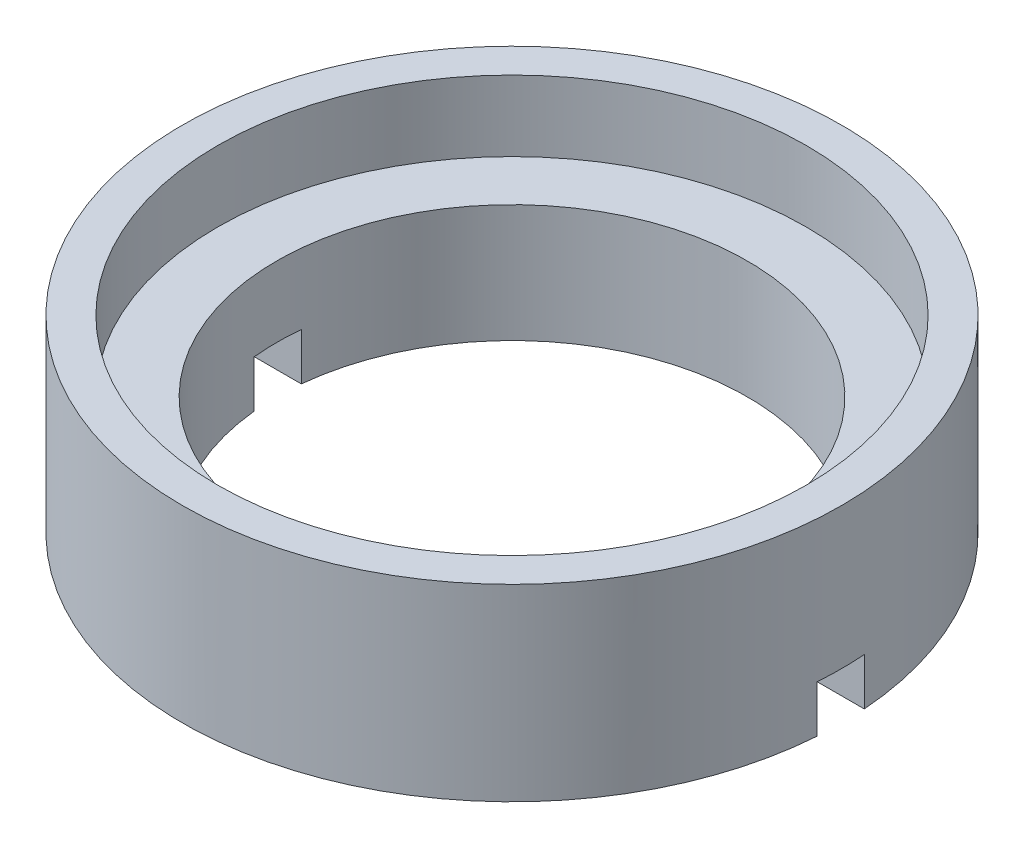
from build123d import *

# Parameters (mm, degrees)
SKETCH1_R           = 7
BOSS_EXTRUDE1_DEPTH = 4
SKETCH2_R           = 6.25
CUT_EXTRUDE1_DEPTH  = 1.5
SKETCH3_R           = 5
CUT_EXTRUDE2_DEPTH  = 11.677078252
SKETCH4_W           = 16
SKETCH4_H           = 1
CUT_EXTRUDE3_DEPTH  = 1


with BuildPart() as part:
    # Sketch1 → Boss-Extrude1 (new body)
    with BuildSketch(Plane(origin=(0, 0, 0), x_dir=(1, 0, 0), z_dir=(0, 1, 0))):
        Circle(SKETCH1_R)
    extrude(amount=BOSS_EXTRUDE1_DEPTH)

    # Sketch2 → Cut-Extrude1 (cut)
    with BuildSketch(Plane(origin=(0, 4, 0), x_dir=(1, 0, 0), z_dir=(0, 1, 0))):
        Circle(SKETCH2_R)
    extrude(amount=-CUT_EXTRUDE1_DEPTH, mode=Mode.SUBTRACT)

    # Sketch3 → Cut-Extrude2 (cut, through all)
    with BuildSketch(Plane.XZ):
        Circle(SKETCH3_R)
    extrude(amount=-CUT_EXTRUDE2_DEPTH, mode=Mode.SUBTRACT)

    # Sketch4 → Cut-Extrude3 (cut)
    with BuildSketch(Plane.XZ):
        Rectangle(SKETCH4_W, SKETCH4_H)
    extrude(amount=-CUT_EXTRUDE3_DEPTH, mode=Mode.SUBTRACT)


solid = part.part
